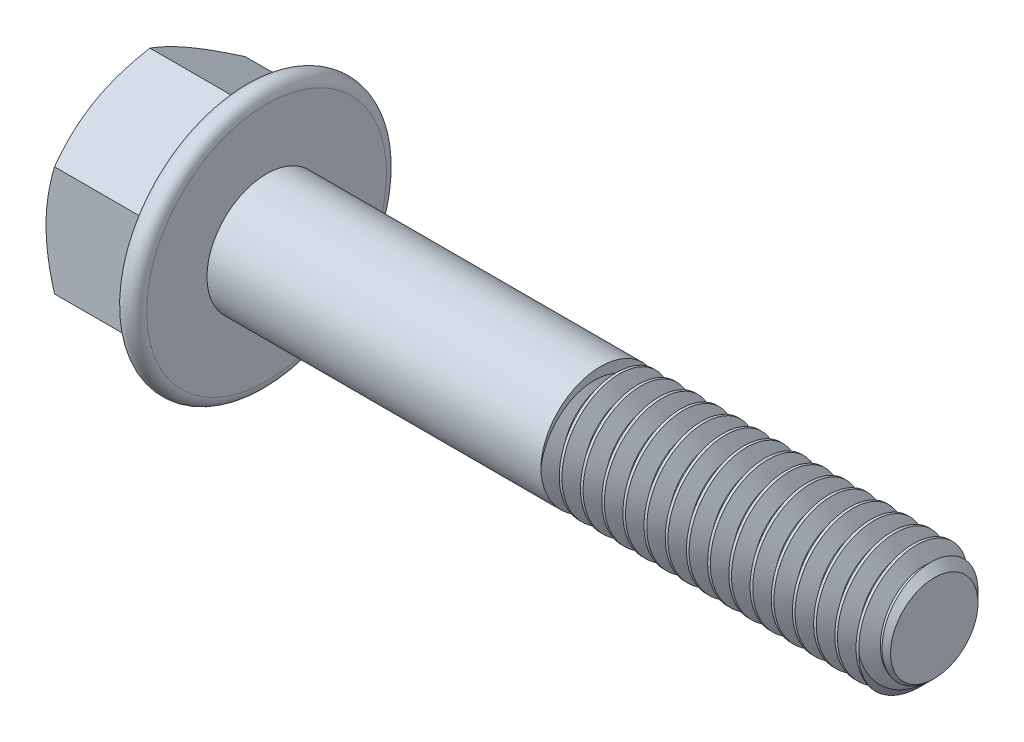
from build123d import *
from build123d.topology import SkipClean

# Parameters (mm, degrees)
SKETCH2_R           = 3.96875
BOSS_EXTRUDE1_DEPTH = 44.45
CHAMFER1_SIZE       = 1.058333333
CUT_SWEEP1_PITCH    = 1.411111111
BOSS_EXTRUDE2_DEPTH = 8.334375
SKETCH5_OUTSIDE_W   = 59.988
SKETCH5_OUTSIDE_H   = 59.988
SKETCH5_OUTSIDE_R   = 6.35
CUT_EXTRUDE1_DEPTH  = 8.334375
CUT_EXTRUDE1_DRAFT  = -60
SKETCH6_R           = 5.715
CUT_EXTRUDE2_DEPTH  = 0.69453125
CUT_EXTRUDE2_DRAFT  = -35
CUT_EXTRUDE3_DEPTH  = 0.254
CIRPATTERN1_COUNT   = 6
SKETCH14_W          = 22.225
SKETCH14_H          = 3.96875


with BuildPart() as part:
    # Sketch2 → Boss-Extrude1 (new body)
    with BuildSketch(Plane(origin=(0, 0, 0), x_dir=(0, 0, -1), z_dir=(1, 0, 0))):
        Circle(SKETCH2_R)
    extrude(amount=BOSS_EXTRUDE1_DEPTH)

    # Chamfer1
    chamfer1_edges = [part.edges().sort_by_distance(p)[0] for p in [
        (44.45, 0, 3.96875),
    ]]
    chamfer(chamfer1_edges, length=CHAMFER1_SIZE)

    # Cut-Sweep1: arcs per turn and ends read off the stored shape
    # Cut-Sweep1: the profile of Sketch13 profile screwed along a right-hand helix through 32.5 turns, 8 arcs to a turn; built about Z, then put on its axis
    cut_sweep1_z = Axis((0, 0, 0), (0, 0, 1))
    cut_sweep1_corners = [(3.96905, 0, 0.000173205), (3.052206448, 0, -0.529166667), (3.052206448, 0, -0.705555556), (3.96905, 0, -1.234895427)]
    with BuildLine(mode=Mode.PRIVATE) as cut_sweep1_profile:
        Line(cut_sweep1_corners[0], cut_sweep1_corners[1])
        Line(cut_sweep1_corners[1], cut_sweep1_corners[2])
        Line(cut_sweep1_corners[2], cut_sweep1_corners[3])
        Line(cut_sweep1_corners[3], cut_sweep1_corners[0])
    cut_sweep1_cap = Face(cut_sweep1_profile.wire())
    cut_sweep1_turn_angles = [0, 22.5, 45, 67.5, 90, 112.5, 135, 157.5, 180, 202.5, 225, 247.5, 270, 292.5, 315, 337.5, 360]
    cut_sweep1_turn_weights = [1, 0.9238795325112867, 1, 0.9238795325112867, 1, 0.9238795325112867, 1, 0.9238795325112867, 1, 0.9238795325112867, 1, 0.9238795325112867, 1, 0.9238795325112867, 1, 0.9238795325112867, 1]
    cut_sweep1_turn_rails = [Edge.make_bspline([Vector(p[0], p[1], 0).rotate(cut_sweep1_z, cut_sweep1_turn_angles[k]) / cut_sweep1_turn_weights[k] + Vector(0, 0, p[2] + CUT_SWEEP1_PITCH * cut_sweep1_turn_angles[k] / 360) for k in range(17)], [0, 0, 0, 1, 1, 2, 2, 3, 3, 4, 4, 5, 5, 6, 6, 7, 7, 8, 8, 8], 2, cut_sweep1_turn_weights) for p in cut_sweep1_corners]
    cut_sweep1_turn_sides = [Face.make_surface_from_curves(cut_sweep1_turn_rails[p[0]], cut_sweep1_turn_rails[p[1]]) for p in [(0, 1), (1, 2), (2, 3), (3, 0)]]
    cut_sweep1_last_angles = [11520, 11542.5, 11565, 11587.5, 11610, 11632.5, 11655, 11677.5, 11700]
    cut_sweep1_last_weights = [1, 0.9238795325112867, 1, 0.9238795325112867, 1, 0.9238795325112867, 1, 0.9238795325112017, 1]
    cut_sweep1_last_rails = [Edge.make_bspline([Vector(p[0], p[1], 0).rotate(cut_sweep1_z, cut_sweep1_last_angles[k]) / cut_sweep1_last_weights[k] + Vector(0, 0, p[2] + CUT_SWEEP1_PITCH * cut_sweep1_last_angles[k] / 360) for k in range(9)], [0, 0, 0, 1, 1, 2, 2, 3, 3, 4, 4, 4], 2, cut_sweep1_last_weights) for p in cut_sweep1_corners]
    cut_sweep1_last_sides = [Face.make_surface_from_curves(cut_sweep1_last_rails[p[0]], cut_sweep1_last_rails[p[1]]) for p in [(0, 1), (1, 2), (2, 3), (3, 0)]]
    cut_sweep1 = Plane(origin=(44.45, 0, 0), x_dir=(0, 1, 0), z_dir=(-1, 0, 0)) * Solid(Shell([*[p.moved(Location((0, 0, CUT_SWEEP1_PITCH * i))) for i in range(32) for p in cut_sweep1_turn_sides], *cut_sweep1_last_sides, cut_sweep1_cap, cut_sweep1_cap.rotate(cut_sweep1_z, 11700).moved(Location((0, 0, CUT_SWEEP1_PITCH * 11700 / 360)))]))
    add(cut_sweep1, mode=Mode.SUBTRACT)

    # Sketch3 → Boss-Extrude2 (add)
    with BuildSketch(Plane.ZY):
        Polygon((0, 7.332348419), (-6.35, 3.666174209), (-6.35, -3.666174209), (0, -7.332348419), (6.35, -3.666174209), (6.35, 3.666174209), align=None)
    extrude(amount=BOSS_EXTRUDE2_DEPTH)

    # Sketch4 → Revolve1 (revolve)
    with BuildSketch(Plane.XY, mode=Mode.PRIVATE) as revolve1_sk:
        with BuildLine():
            Line((0, 0), (0, 7.98685365))
            ThreePointArc((0, 7.98685365), (-0.551732398, 8.705885309), (-1.3890625, 8.359051825))
            Line((-1.3890625, 8.359051825), (-2.548989112, 6.35))
            Line((-2.548989112, 6.35), (-2.548989112, 0))
            Line((-2.548989112, 0), (0, 0))
        make_face()
    revolve(revolve1_sk.sketch.rotate(Axis((-2.548989112, 0, 0), (1, 0, 0)), 180), axis=Axis((-2.548989112, 0, 0), (1, 0, 0)))


with BuildPart() as cut_extrude1_tool:
    # Sketch5 outside → Cut-Extrude1 (with draft: the straight prism first)
    with BuildSketch(Plane.ZY.offset(8.334375)):
        Rectangle(SKETCH5_OUTSIDE_W, SKETCH5_OUTSIDE_H)
        Circle(SKETCH5_OUTSIDE_R, mode=Mode.SUBTRACT)
    extrude(amount=-CUT_EXTRUDE1_DEPTH)
    # Cut-Extrude1: the draft: its side faces are tilted about the plane it starts from
    cut_extrude1_sides = [cut_extrude1_tool.faces().sort_by_distance(p)[0] for p in [
        (-4.1671875, -29.994, 0),
        (-4.1671875, 0, 29.994),
        (-4.1671875, 29.994, 0),
        (-4.1671875, 0, -29.994),
        (-4.1671875, 0, -6.35),
    ]]
    draft(cut_extrude1_sides, Plane.ZY.offset(8.334375), CUT_EXTRUDE1_DRAFT)


with BuildPart() as part_1:
    add(part.part)

    # Cut-Extrude1: cut by cut_extrude1_tool
    add(cut_extrude1_tool.part, mode=Mode.SUBTRACT)


with BuildPart() as cut_extrude2_tool:
    # Sketch6 → Cut-Extrude2 (with draft: the straight prism first)
    with BuildSketch(Plane.ZY.offset(8.334375)):
        Circle(SKETCH6_R)
    extrude(amount=-CUT_EXTRUDE2_DEPTH)
    # Cut-Extrude2: the draft: its side faces are tilted about the plane it starts from
    cut_extrude2_sides = [cut_extrude2_tool.faces().sort_by_distance(p)[0] for p in [
        (-7.987109375, 0, -5.715),
    ]]
    draft(cut_extrude2_sides, Plane.ZY.offset(8.334375), CUT_EXTRUDE2_DRAFT)


with BuildPart() as part_2:
    add(part_1.part)

    # Cut-Extrude2: cut by cut_extrude2_tool
    add(cut_extrude2_tool.part, mode=Mode.SUBTRACT)

    # Sketch11 → Cut-Extrude3 (cut)
    with BuildSketch(Plane.ZY.offset(7.63984375)):
        with BuildLine():
            Line((0.1905, 4.8895), (0.1905, 1.7145))
            ThreePointArc((0.1905, 1.7145), (0, 1.524), (-0.1905, 1.7145))
            Line((-0.1905, 1.7145), (-0.1905, 4.8895))
            ThreePointArc((-0.1905, 4.8895), (0, 5.08), (0.1905, 4.8895))
        make_face()
    cut_extrude3 = extrude(amount=-CUT_EXTRUDE3_DEPTH, mode=Mode.SUBTRACT)

    # CirPattern1: Cut-Extrude3 ×6 about axis
    cirpattern1_axis = Axis((0, 0, 0), (1, 0, 0))
    for i in range(1, CIRPATTERN1_COUNT):
        add(cut_extrude3.rotate(cirpattern1_axis, i * 360 / CIRPATTERN1_COUNT), mode=Mode.SUBTRACT)

    # Sketch14 → Revolve2 (revolve)
    with SkipClean():  # the faces are left unmerged after this step: merging them gives an invalid solid
        with BuildSketch(Plane.XY, mode=Mode.PRIVATE) as revolve2_sk:
            with Locations((11.1125, 1.984375)):
                Rectangle(SKETCH14_W, SKETCH14_H)
        revolve(revolve2_sk.sketch.rotate(Axis((0, 0, 0), (1, 0, 0)), 90), axis=Axis((0, 0, 0), (1, 0, 0)))


solid = part_2.part
